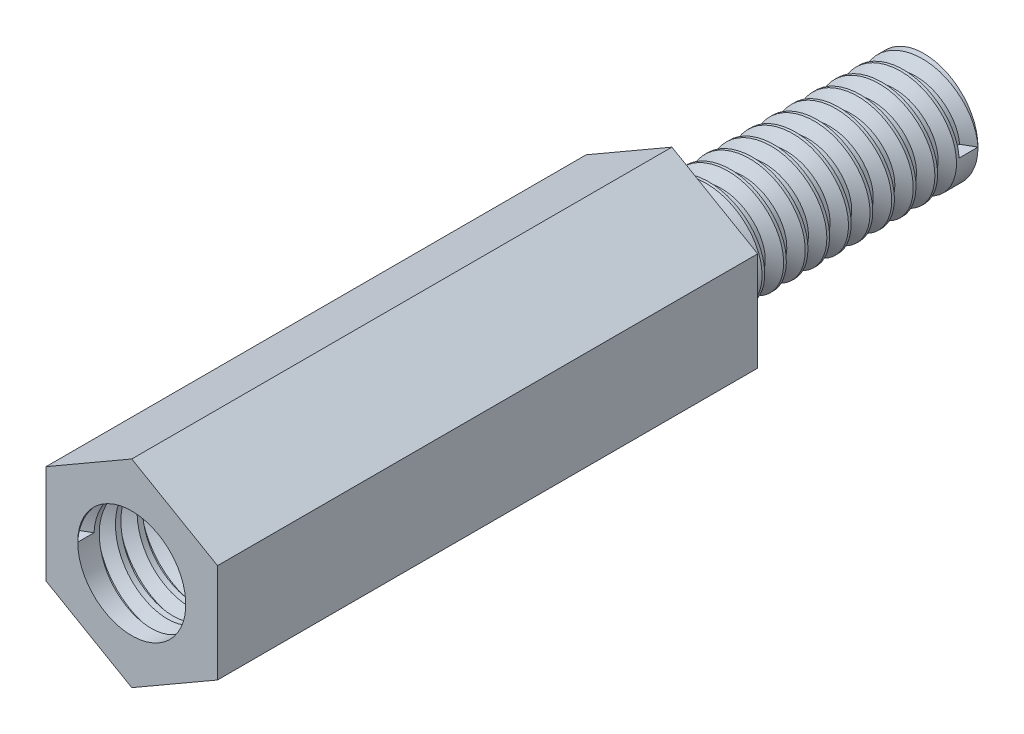
from build123d import *
from build123d.topology import SkipClean

# Parameters (mm, degrees)
BOSS_EXTRUDE1_DEPTH = 15
SKETCH2_R           = 1.5
CUT_EXTRUDE1_DEPTH  = 7
SKETCH3_R           = 1.5
BOSS_EXTRUDE2_DEPTH = 7
THREAD1_PITCH       = 0.6
THREAD2_PITCH       = 0.6


with BuildPart() as part:
    # Sketch1 → Boss-Extrude1 (new body)
    with BuildSketch(Plane.XY):
        Polygon((-2.38156986, -1.375), (0, -2.75), (2.38156986, -1.375), (2.38156986, 1.375), (0, 2.75), (-2.38156986, 1.375), align=None)
    extrude(amount=BOSS_EXTRUDE1_DEPTH)

    # Sketch2 → Cut-Extrude1 (cut)
    with BuildSketch(Plane.XY.offset(15)):
        Circle(SKETCH2_R)
    extrude(amount=-CUT_EXTRUDE1_DEPTH, mode=Mode.SUBTRACT)

    # Sketch3 → Boss-Extrude2 (add)
    with BuildSketch(Plane(origin=(0, 0, 0), x_dir=(-1, 0, 0), z_dir=(0, 0, -1))):
        with Locations(Location((0, 0, 0), (0, 0, 180))):
            Circle(SKETCH3_R)
    extrude(amount=BOSS_EXTRUDE2_DEPTH)

    # Thread1: the profile of Thread Profile1 profile screwed along a right-hand helix of 11.666667 turns, 6 arcs to a turn; built about Z, then put on its axis
    thread1_z = Axis((0, 0, 0), (0, 0, 1))
    thread1_corners = [(1.5003, 0, -0.000173205), (1.5003, 0, 0.525173203), (1.175240475, 0, 0.337499999), (1.175240475, 0, 0.187499999)]
    with BuildLine(mode=Mode.PRIVATE) as thread1_profile:
        Line(thread1_corners[0], thread1_corners[1])
        Line(thread1_corners[1], thread1_corners[2])
        Line(thread1_corners[2], thread1_corners[3])
        Line(thread1_corners[3], thread1_corners[0])
    thread1_cap = Face(thread1_profile.wire())
    thread1_turn_angles = [0, 30, 60, 90, 120, 150, 180, 210, 240, 270, 300, 330, 360]
    thread1_turn_weights = [1, 0.8660254037844387, 1, 0.8660254037844387, 1, 0.8660254037844387, 1, 0.8660254037844387, 1, 0.8660254037844387, 1, 0.8660254037844387, 1]
    thread1_turn_rails = [Edge.make_bspline([Vector(p[0], p[1], 0).rotate(thread1_z, thread1_turn_angles[k]) / thread1_turn_weights[k] + Vector(0, 0, p[2] + THREAD1_PITCH * thread1_turn_angles[k] / 360) for k in range(13)], [0, 0, 0, 1, 1, 2, 2, 3, 3, 4, 4, 5, 5, 6, 6, 6], 2, thread1_turn_weights) for p in thread1_corners]
    thread1_turn_sides = [Face.make_surface_from_curves(thread1_turn_rails[p[0]], thread1_turn_rails[p[1]]) for p in [(0, 1), (1, 2), (2, 3), (3, 0)]]
    thread1_last_angles = [3960, 3990, 4020, 4050, 4080, 4110, 4140, 4170, 4200]
    thread1_last_weights = [1, 0.8660254037844387, 1, 0.8660254037844387, 1, 0.8660254037844387, 1, 0.8660254037844387, 1]
    thread1_last_rails = [Edge.make_bspline([Vector(p[0], p[1], 0).rotate(thread1_z, thread1_last_angles[k]) / thread1_last_weights[k] + Vector(0, 0, p[2] + THREAD1_PITCH * thread1_last_angles[k] / 360) for k in range(9)], [0, 0, 0, 1, 1, 2, 2, 3, 3, 4, 4, 4], 2, thread1_last_weights) for p in thread1_corners]
    thread1_last_sides = [Face.make_surface_from_curves(thread1_last_rails[p[0]], thread1_last_rails[p[1]]) for p in [(0, 1), (1, 2), (2, 3), (3, 0)]]
    thread1 = Plane(origin=(0, 0, -7), x_dir=(1, 0, 0), z_dir=(0, 0, 1)) * Solid(Shell([*[p.moved(Location((0, 0, THREAD1_PITCH * i))) for i in range(11) for p in thread1_turn_sides], *thread1_last_sides, thread1_cap, thread1_cap.rotate(thread1_z, 4200).moved(Location((0, 0, THREAD1_PITCH * 4200 / 360)))]))
    add(thread1, mode=Mode.SUBTRACT)

    # Thread2: the profile of Thread Profile2 profile screwed along a right-hand helix of 11.666667 turns, 6 arcs to a turn; built about Z, then put on its axis
    with SkipClean():  # the faces are left unmerged after this step: merging them gives an invalid solid
        thread2_z = Axis((0, 0, 0), (0, 0, 1))
        thread2_corners = [(1.4997, 0, -0.000173205), (1.824759525, 0, 0.187499999), (1.824759525, 0, 0.262499999), (1.4997, 0, 0.450173203)]
        with BuildLine(mode=Mode.PRIVATE) as thread2_profile:
            Line(thread2_corners[0], thread2_corners[1])
            Line(thread2_corners[1], thread2_corners[2])
            Line(thread2_corners[2], thread2_corners[3])
            Line(thread2_corners[3], thread2_corners[0])
        thread2_cap = Face(thread2_profile.wire())
        thread2_turn_angles = [0, 30, 60, 90, 120, 150, 180, 210, 240, 270, 300, 330, 360]
        thread2_turn_weights = [1, 0.8660254037844387, 1, 0.8660254037844387, 1, 0.8660254037844387, 1, 0.8660254037844387, 1, 0.8660254037844387, 1, 0.8660254037844387, 1]
        thread2_turn_rails = [Edge.make_bspline([Vector(p[0], p[1], 0).rotate(thread2_z, thread2_turn_angles[k]) / thread2_turn_weights[k] + Vector(0, 0, p[2] + THREAD2_PITCH * thread2_turn_angles[k] / 360) for k in range(13)], [0, 0, 0, 1, 1, 2, 2, 3, 3, 4, 4, 5, 5, 6, 6, 6], 2, thread2_turn_weights) for p in thread2_corners]
        thread2_turn_sides = [Face.make_surface_from_curves(thread2_turn_rails[p[0]], thread2_turn_rails[p[1]]) for p in [(0, 1), (1, 2), (2, 3), (3, 0)]]
        thread2_last_angles = [3960, 3990, 4020, 4050, 4080, 4110, 4140, 4170, 4200]
        thread2_last_weights = [1, 0.8660254037844387, 1, 0.8660254037844387, 1, 0.8660254037844387, 1, 0.8660254037844426, 1]
        thread2_last_rails = [Edge.make_bspline([Vector(p[0], p[1], 0).rotate(thread2_z, thread2_last_angles[k]) / thread2_last_weights[k] + Vector(0, 0, p[2] + THREAD2_PITCH * thread2_last_angles[k] / 360) for k in range(9)], [0, 0, 0, 1, 1, 2, 2, 3, 3, 4, 4, 4], 2, thread2_last_weights) for p in thread2_corners]
        thread2_last_sides = [Face.make_surface_from_curves(thread2_last_rails[p[0]], thread2_last_rails[p[1]]) for p in [(0, 1), (1, 2), (2, 3), (3, 0)]]
        thread2 = Plane(origin=(0, 0, 15), x_dir=(-1, 0, 0), z_dir=(0, 0, -1)) * Solid(Shell([*[p.moved(Location((0, 0, THREAD2_PITCH * i))) for i in range(11) for p in thread2_turn_sides], *thread2_last_sides, thread2_cap, thread2_cap.rotate(thread2_z, 4200).moved(Location((0, 0, THREAD2_PITCH * 4200 / 360)))]))
        add(thread2, mode=Mode.SUBTRACT)


solid = part.part
